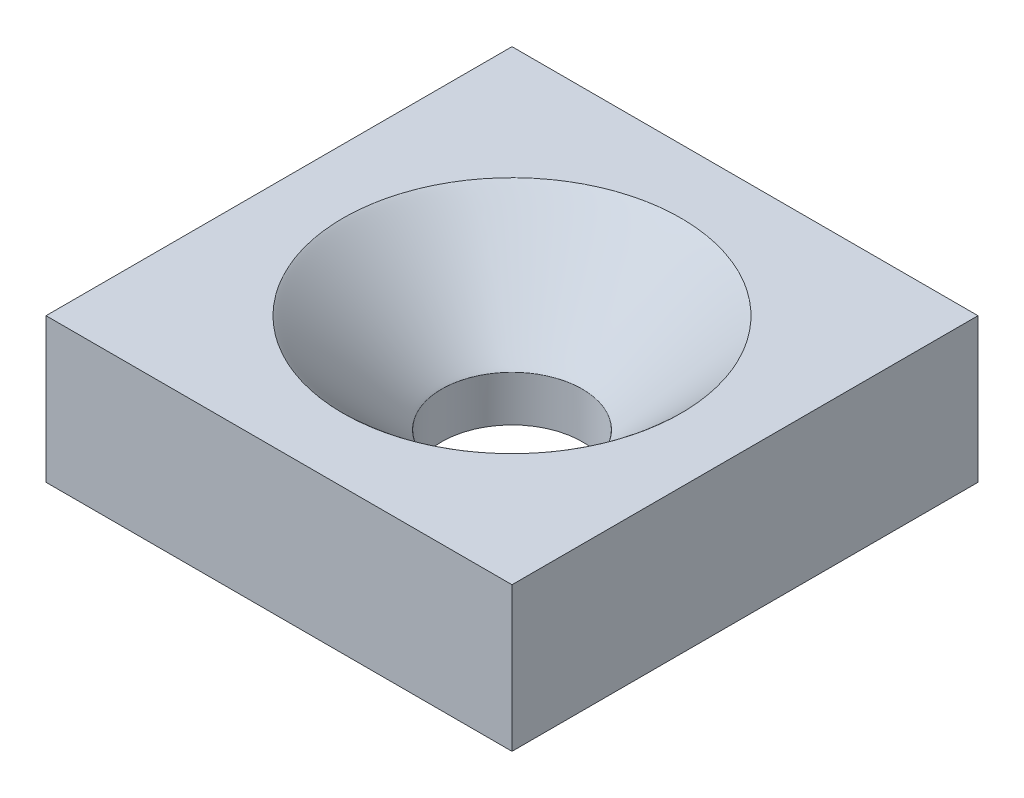
from build123d import *

# Parameters (mm, degrees)
SKETCH1_W               = 15.577947364
SKETCH1_H               = 15.577947364
BOSS_EXTRUDE2_DEPTH     = 10
CUT_EXTRUDE1_DEPTH      = 15.877372821
CUT_EXTRUDE1_DEPTH_BACK = 15.877372821
SKETCH2_R               = 2.35
FILLET3_SIZE            = 3.3
CUT_EXTRUDE2_DEPTH      = 21.083340288
CUT_EXTRUDE2_DEPTH_BACK = 21.083340288
SKETCH9_W               = 17.356055064
SKETCH9_H               = 10.947578027


with BuildPart() as part:
    # Sketch1 → Boss-Extrude2 (new body)
    with BuildSketch(Plane(origin=(0, 0, 0), x_dir=(1, 0, 0), z_dir=(0, 1, 0))):
        Rectangle(SKETCH1_W, SKETCH1_H)
    extrude(amount=BOSS_EXTRUDE2_DEPTH)

    # Sketch2 → Cut-Extrude1 (cut, two sides: drawn at the far end of the back side and taken through both)
    with BuildSketch(Plane(origin=(0, 10, 0), x_dir=(1, 0, 0), z_dir=(0, 1, 0)).offset(-CUT_EXTRUDE1_DEPTH_BACK)):
        with Locations(Location((0, 0, 0), (0, 0, 270))):
            Circle(SKETCH2_R)
    extrude(amount=CUT_EXTRUDE1_DEPTH + CUT_EXTRUDE1_DEPTH_BACK, mode=Mode.SUBTRACT)

    # Fillet3
    # a fillet whose section is not a circle: 3.3 mm, written as the material it takes off along each edge
    with BuildSketch(Plane(origin=(0, 10, 0), x_dir=(0, 0, 1), z_dir=(-1, 0, 0))) as fillet3_piece_1:
        with BuildLine():
            Bezier((2.35 + FILLET3_SIZE, 0), (2.35, 0), (2.35, -FILLET3_SIZE), weights=[1, 0.016667517, 1])
            Line((2.35, -FILLET3_SIZE), (2.35, 0))
            Line((2.35, 0), (2.35 + FILLET3_SIZE, 0))
        make_face()
    revolve(axis=Axis((0, 10, 0), (0, 1, 0)), mode=Mode.SUBTRACT)

    # Sketch9 → Cut-Extrude2 (cut, two sides: drawn at the far end of the back side and taken through both)
    with BuildSketch(Plane.ZY.offset(7.788973682).offset(-CUT_EXTRUDE2_DEPTH_BACK)):
        with Locations((-0.203270831, -0.297866067)):
            Rectangle(SKETCH9_W, SKETCH9_H)
    extrude(amount=CUT_EXTRUDE2_DEPTH + CUT_EXTRUDE2_DEPTH_BACK, mode=Mode.SUBTRACT)


solid = part.part
